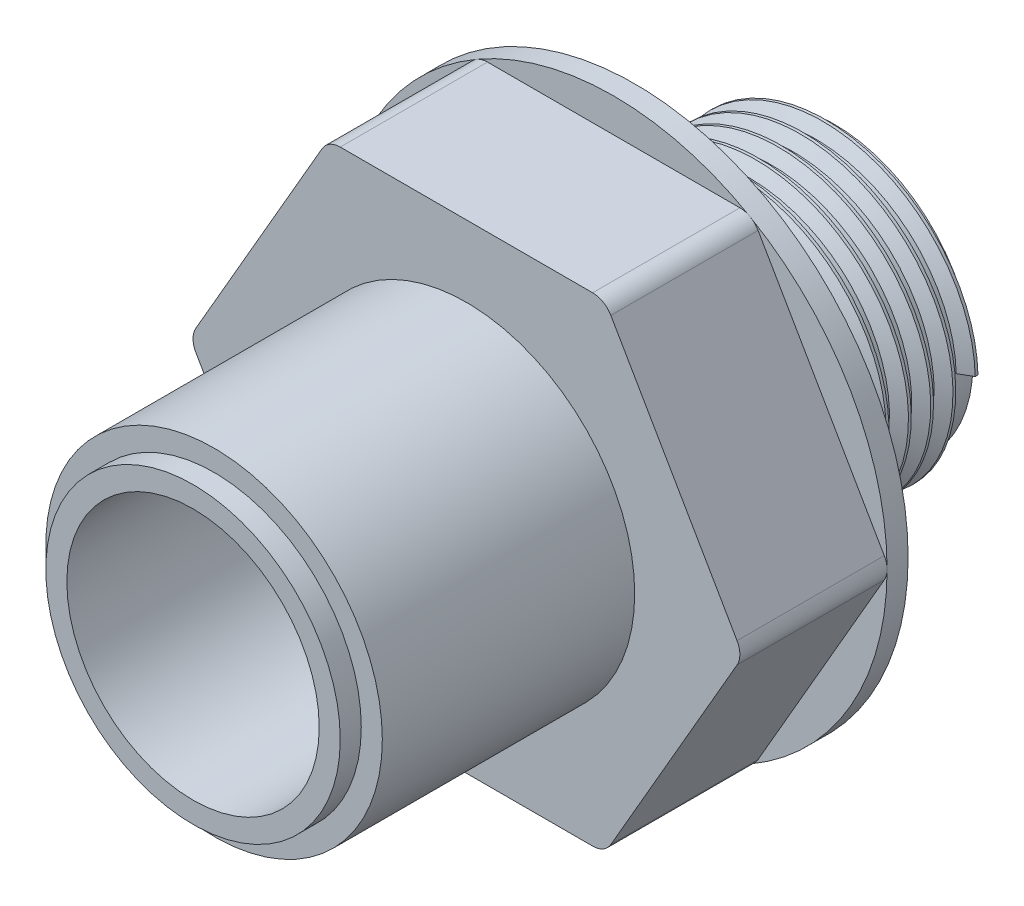
from build123d import *

# Parameters (mm, degrees)
THREAD1_PITCH      = 1.058333333
SKETCH6_OUTSIDE_W  = 37.554
SKETCH6_OUTSIDE_H  = 37.554
SKETCH6_OUTSIDE_R  = 7
CUT_EXTRUDE1_DEPTH = 1
SKETCH8_OUTSIDE_W  = 37.554
SKETCH8_OUTSIDE_H  = 37.554
CUT_EXTRUDE3_DEPTH = 7
SKETCH9_R          = 6
CUT_EXTRUDE4_DEPTH = 21


with BuildPart() as part:
    # Sketch2 → Revolve1 (revolve)
    with BuildSketch(Plane(origin=(0, 0, 0), x_dir=(0, 0, -1), z_dir=(1, 0, 0)), mode=Mode.PRIVATE) as revolve1_sk:
        Polygon((0, 4.25), (30.5, 4.25), (30.5, 6.58), (21, 6.58), (21, 13), (13, 13), (13, 8), (0, 8), align=None)
    revolve(revolve1_sk.sketch.rotate(Axis((0, 0, 17.665917422), (0, 0, -1)), 90), axis=Axis((0, 0, 17.665917422), (0, 0, -1)))

    # Thread1: the profile of Thread Profile1 profile screwed along a right-hand helix of 8.976378 turns, 8 arcs to a turn; built about Z, then put on its axis
    thread1_z = Axis((0, 0, 0), (0, 0, 1))
    thread1_corners = [(6.5797, 0, -0.000173205), (7.152839718, 0, 0.330729165), (7.152839718, 0, 0.463020832), (6.5797, 0, 0.793923202)]
    with BuildLine(mode=Mode.PRIVATE) as thread1_profile:
        Line(thread1_corners[0], thread1_corners[1])
        Line(thread1_corners[1], thread1_corners[2])
        Line(thread1_corners[2], thread1_corners[3])
        Line(thread1_corners[3], thread1_corners[0])
    thread1_cap = Face(thread1_profile.wire())
    thread1_turn_angles = [0, 22.5, 45, 67.5, 90, 112.5, 135, 157.5, 180, 202.5, 225, 247.5, 270, 292.5, 315, 337.5, 360]
    thread1_turn_weights = [1, 0.9238795325112867, 1, 0.9238795325112867, 1, 0.9238795325112867, 1, 0.9238795325112867, 1, 0.9238795325112867, 1, 0.9238795325112867, 1, 0.9238795325112867, 1, 0.9238795325112867, 1]
    thread1_turn_rails = [Edge.make_bspline([Vector(p[0], p[1], 0).rotate(thread1_z, thread1_turn_angles[k]) / thread1_turn_weights[k] + Vector(0, 0, p[2] + THREAD1_PITCH * thread1_turn_angles[k] / 360) for k in range(17)], [0, 0, 0, 1, 1, 2, 2, 3, 3, 4, 4, 5, 5, 6, 6, 7, 7, 8, 8, 8], 2, thread1_turn_weights) for p in thread1_corners]
    thread1_turn_sides = [Face.make_surface_from_curves(thread1_turn_rails[p[0]], thread1_turn_rails[p[1]]) for p in [(0, 1), (1, 2), (2, 3), (3, 0)]]
    thread1_last_angles = [2880, 2902.5, 2925, 2947.5, 2970, 2992.5, 3015, 3037.5, 3060, 3082.5, 3105, 3127.5, 3150, 3172.5, 3195, 3213.248031496, 3231.496062992]
    thread1_last_weights = [1, 0.9238795325112867, 1, 0.9238795325112867, 1, 0.9238795325112867, 1, 0.9238795325112867, 1, 0.9238795325112867, 1, 0.9238795325112867, 1, 0.9238795325112867, 1, 0.9497098849711283, 1]
    thread1_last_rails = [Edge.make_bspline([Vector(p[0], p[1], 0).rotate(thread1_z, thread1_last_angles[k]) / thread1_last_weights[k] + Vector(0, 0, p[2] + THREAD1_PITCH * thread1_last_angles[k] / 360) for k in range(17)], [0, 0, 0, 1, 1, 2, 2, 3, 3, 4, 4, 5, 5, 6, 6, 7, 7, 8, 8, 8], 2, thread1_last_weights) for p in thread1_corners]
    thread1_last_sides = [Face.make_surface_from_curves(thread1_last_rails[p[0]], thread1_last_rails[p[1]]) for p in [(0, 1), (1, 2), (2, 3), (3, 0)]]
    thread1 = Plane(origin=(0, 0, -30.5), x_dir=(1, 0, 0), z_dir=(0, 0, 1)) * Solid(Shell([*[p.moved(Location((0, 0, THREAD1_PITCH * i))) for i in range(8) for p in thread1_turn_sides], *thread1_last_sides, thread1_cap, thread1_cap.rotate(thread1_z, 3231.496062992).moved(Location((0, 0, THREAD1_PITCH * 3231.496062992 / 360)))]))
    add(thread1)

    # Sketch6 outside → Cut-Extrude1 (cut)
    with BuildSketch(Plane.XY):
        Rectangle(SKETCH6_OUTSIDE_W, SKETCH6_OUTSIDE_H)
        Circle(SKETCH6_OUTSIDE_R, mode=Mode.SUBTRACT)
    extrude(amount=-CUT_EXTRUDE1_DEPTH, mode=Mode.SUBTRACT)

    # Sketch8 outside → Cut-Extrude3 (cut)
    with BuildSketch(Plane.XY.offset(-13)):
        Rectangle(SKETCH8_OUTSIDE_W, SKETCH8_OUTSIDE_H)
        with BuildLine():
            Line((-6, 11.392304845), (6, 11.392304845))
            ThreePointArc((6, 11.392304845), (6.5, 11.258330249), (6.866025404, 10.892304845))
            Line((6.866025404, 10.892304845), (12.866025404, 0.5))
            ThreePointArc((12.866025404, 0.5), (13, 0), (12.866025404, -0.5))
            Line((12.866025404, -0.5), (6.866025404, -10.892304845))
            ThreePointArc((6.866025404, -10.892304845), (6.5, -11.258330249), (6, -11.392304845))
            Line((6, -11.392304845), (-6, -11.392304845))
            ThreePointArc((-6, -11.392304845), (-6.5, -11.258330249), (-6.866025404, -10.892304845))
            Line((-6.866025404, -10.892304845), (-12.866025404, -0.5))
            ThreePointArc((-12.866025404, -0.5), (-13, 0), (-12.866025404, 0.5))
            Line((-12.866025404, 0.5), (-6.866025404, 10.892304845))
            ThreePointArc((-6.866025404, 10.892304845), (-6.5, 11.258330249), (-6, 11.392304845))
        make_face(mode=Mode.SUBTRACT)
    extrude(amount=-CUT_EXTRUDE3_DEPTH, mode=Mode.SUBTRACT)

    # Sketch9 → Cut-Extrude4 (cut)
    with BuildSketch(Plane.XY):
        Circle(SKETCH9_R)
    extrude(amount=-CUT_EXTRUDE4_DEPTH, mode=Mode.SUBTRACT)


solid = part.part
